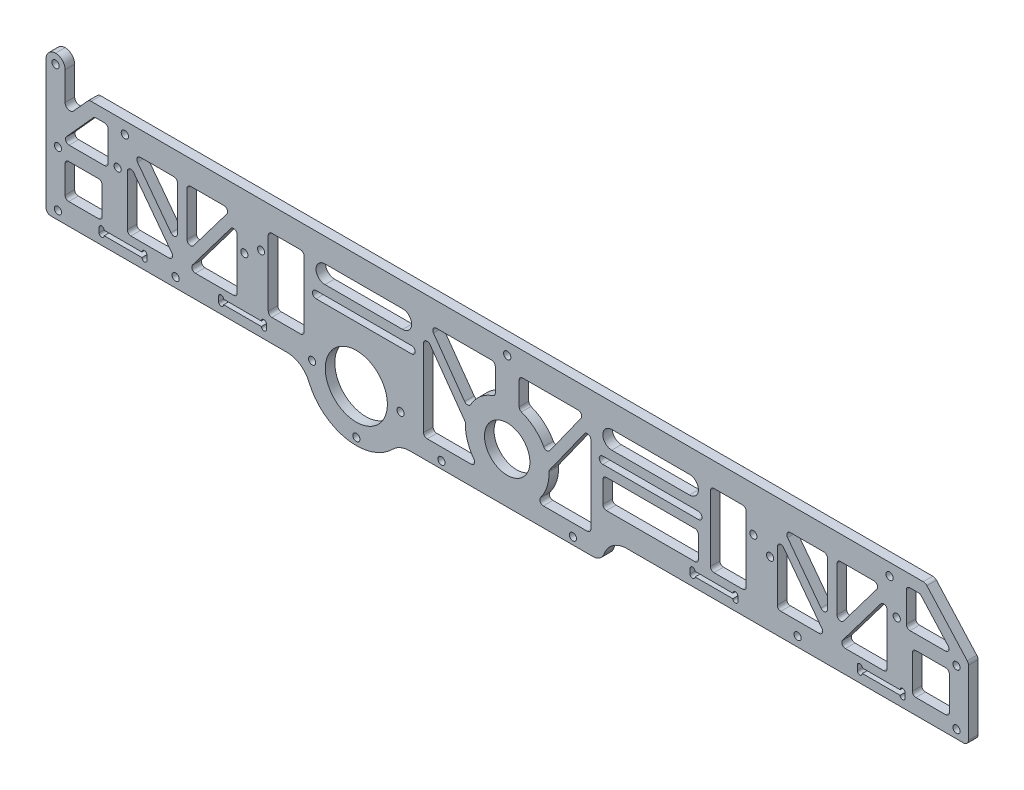
from build123d import *
from build123d.topology import SkipClean

# Parameters (mm, degrees)
SKETCH_1_W           = 386
SKETCH_1_H           = 50
EXTRUDE_1_DEPTH      = 4
SKETCH_2_R           = 1.525
CUT_EXTRUDE_1_DEPTH  = 33
SKETCH_3_R           = 1.5
CUT_EXTRUDE_2_DEPTH  = 5
SKETCH_4_W           = 80
SKETCH_4_H           = 20
EXTRUDE_3_DEPTH      = 4
FILLET_1_R           = 10
FILLET_2_R           = 5
SKETCH_5_R           = 9.5
CUT_EXTRUDE_3_DEPTH  = 40
SKETCH_6_W           = 45
SKETCH_6_H           = 10
EXTRUDE_4_DEPTH      = 4
SKETCH_7_R           = 6.55
CUT_EXTRUDE_4_DEPTH  = 10
SKETCH_8_R           = 21.512162348
SKETCH_8_R_2         = 6.55
EXTRUDE_5_DEPTH      = 4
SKETCH_10_R          = 13
CUT_EXTRUDE_5_DEPTH  = 21
CUT_EXTRUDE_6_DEPTH  = 10
SKETCH_12_R          = 1.5
CUT_EXTRUDE_7_DEPTH  = 10
CUT_EXTRUDE_8_DEPTH  = 10
SKETCH_15_R          = 1.5
CUT_EXTRUDE_9_DEPTH  = 10
SKETCH_16_R          = 1.5
CUT_EXTRUDE_10_DEPTH = 10
SKETCH_17_R          = 1.5
CUT_EXTRUDE_11_DEPTH = 10
SKETCH_18_R          = 1.5
CUT_EXTRUDE_12_DEPTH = 10
FILLET_3_R           = 10
FILLET_4_R           = 2
SKETCH_20_R          = 1.5
CUT_EXTRUDE_14_DEPTH = 50
SKETCH_21_W          = 20
SKETCH_21_H          = 2
CUT_EXTRUDE_15_DEPTH = 10
SKETCH_22_R          = 1.05
CUT_EXTRUDE_16_DEPTH = 10
SKETCH_23_R          = 1.05
CUT_EXTRUDE_17_DEPTH = 10
SKETCH_24_W          = 15.5
SKETCH_24_H          = 17
SKETCH_24_W_2        = 46
SKETCH_24_H_2        = 30.5
SKETCH_24_W_3        = 15
SKETCH_24_W_4        = 40
SKETCH_24_H_3        = 12
CUT_EXTRUDE_18_DEPTH = 10
EXTRUDE_6_DEPTH      = 4
EXTRUDE_7_DEPTH      = 4
FILLET_5_R           = 1.5
EXTRUDE_START        = -4
EXTRUDE_8_DEPTH      = 4
FILLET_6_R           = 1.5
EXTRUDE_9_DEPTH      = 4
SKETCH_29_R          = 1.5
CUT_EXTRUDE_19_DEPTH = 10
FILLET_7_R           = 4
FILLET_8_R           = 2


with BuildPart() as part:
    # 草图1 → 凸台-拉伸1 (new body)
    with BuildSketch(Plane.XY):
        Rectangle(SKETCH_1_W, SKETCH_1_H)
    extrude(amount=EXTRUDE_1_DEPTH)

    # 草图2 → 切除-拉伸1 (cut)
    with BuildSketch(Plane(origin=(0, 0, 0), x_dir=(-1, 0, 0), z_dir=(0, 0, -1))):
        with Locations((-160, 20)):
            Circle(SKETCH_2_R)
        with Locations((0, 20)):
            Circle(SKETCH_2_R)
        with Locations((160, 20)):
            Circle(SKETCH_2_R)
    extrude(amount=-CUT_EXTRUDE_1_DEPTH, mode=Mode.SUBTRACT)

    # 草图3 → 切除-拉伸2 (cut, symmetric)
    with BuildSketch(Plane(origin=(0, 0, 0), x_dir=(-1, 0, 0), z_dir=(0, 0, -1))):
        with Locations((-103, 6.5)):
            Circle(SKETCH_3_R)
        with Locations((-163, 6.5)):
            Circle(SKETCH_3_R)
        with Locations((163, 6.5)):
            Circle(SKETCH_3_R)
        with Locations((103, 6.5)):
            Circle(SKETCH_3_R)
    extrude(amount=CUT_EXTRUDE_2_DEPTH, both=True, mode=Mode.SUBTRACT)

    # 草图4 → 凸台-拉伸3 (add)
    with BuildSketch(Plane(origin=(0, 0, 0), x_dir=(-1, 0, 0), z_dir=(0, 0, -1))):
        with Locations((0, -25)):
            Rectangle(SKETCH_4_W, SKETCH_4_H)
    extrude(amount=-EXTRUDE_3_DEPTH)

    # 圆角1
    fillet_1_edges = [part.edges().sort_by_distance(p)[0] for p in [
        (-40, -25, 2),
        (40, -25, 2),
    ]]
    fillet(fillet_1_edges, radius=FILLET_1_R - 0.0001)  # a hair under: the kernel refuses the full size

    # 圆角2
    fillet_2_edges = [part.edges().sort_by_distance(p)[0] for p in [
        (40, -35, 2),
        (-40, -35, 2),
    ]]
    fillet(fillet_2_edges, radius=FILLET_2_R)

    # 草图5 → 切除-拉伸3 (cut)
    with BuildSketch(Plane(origin=(0, 0, 0), x_dir=(-1, 0, 0), z_dir=(0, 0, -1))):
        with Locations((0, -14)):
            Circle(SKETCH_5_R)
    extrude(amount=-CUT_EXTRUDE_3_DEPTH, mode=Mode.SUBTRACT)

    # 草图6 → 凸台-拉伸4 (add)
    with BuildSketch(Plane.XY.offset(4)):
        with Locations((-58.357864376, -30)):
            Rectangle(SKETCH_6_W, SKETCH_6_H)
    extrude(amount=-EXTRUDE_4_DEPTH)

    # 草图7 → 切除-拉伸4 (cut)
    with BuildSketch(Plane.XY.offset(4)):
        with Locations((-63.139706208, -22.8)):
            Circle(SKETCH_7_R)
    extrude(amount=-CUT_EXTRUDE_4_DEPTH, mode=Mode.SUBTRACT)

    # 草图8 → 凸台-拉伸5 (add)
    with BuildSketch(Plane.XY.offset(4)):
        with Locations((-63.139706208, -22.8)):
            Circle(SKETCH_8_R)
        with Locations((-63.139706208, -22.8)):
            Circle(SKETCH_8_R_2, mode=Mode.SUBTRACT)
    extrude(amount=-EXTRUDE_5_DEPTH)

    # 草图10 → 切除-拉伸5 (cut)
    with BuildSketch(Plane.XY.offset(4)):
        with Locations((-63.139706208, -22.8)):
            Circle(SKETCH_10_R)
    extrude(amount=-CUT_EXTRUDE_5_DEPTH, mode=Mode.SUBTRACT)

    # 草图11 → 切除-拉伸6 (cut)
    with BuildSketch(Plane.XY.offset(4)):
        with BuildLine():
            Line((-80, 3.5), (-40, 3.5))
            ThreePointArc((-40, 3.5), (-38.5, 2), (-40, 0.5))
            Line((-40, 0.5), (-80, 0.5))
            ThreePointArc((-80, 0.5), (-81.5, 2), (-80, 3.5))
        make_face()
        with BuildLine():
            Line((80, 3.5), (40, 3.5))
            ThreePointArc((40, 3.5), (38.5, 2), (40, 0.5))
            Line((40, 0.5), (80, 0.5))
            ThreePointArc((80, 0.5), (81.5, 2), (80, 3.5))
        make_face()
    extrude(amount=-CUT_EXTRUDE_6_DEPTH, mode=Mode.SUBTRACT)

    # 草图12 → 切除-拉伸7 (cut)
    with BuildSketch(Plane(origin=(0, 0, 0), x_dir=(-1, 0, 0), z_dir=(0, 0, -1))):
        with Locations((-110, 2)):
            Circle(SKETCH_12_R)
        with Locations((110, 2)):
            Circle(SKETCH_12_R)
    extrude(amount=-CUT_EXTRUDE_7_DEPTH, mode=Mode.SUBTRACT)

    # 草图13 → 切除-拉伸8 (cut)
    with BuildSketch(Plane.XY.offset(4)):
        Polygon((-175, 25), (-193, 5), (-193, 25), align=None)
        Polygon((193, 25), (175, 25), (193, 5), align=None)
    extrude(amount=-CUT_EXTRUDE_8_DEPTH, mode=Mode.SUBTRACT)

    # 草图15 → 切除-拉伸9 (cut)
    with BuildSketch(Plane.XY.offset(4)):
        with Locations((-138.769539184, -21)):
            Circle(SKETCH_15_R)
    extrude(amount=-CUT_EXTRUDE_9_DEPTH, mode=Mode.SUBTRACT)

    # 草图16 → 切除-拉伸10 (cut)
    with BuildSketch(Plane.XY.offset(4)):
        with Locations((121.5, -21)):
            Circle(SKETCH_16_R)
    extrude(amount=-CUT_EXTRUDE_10_DEPTH, mode=Mode.SUBTRACT)

    # 草图17 → 切除-拉伸11 (cut)
    with BuildSketch(Plane.XY.offset(4)):
        with Locations((27.5, -32)):
            Circle(SKETCH_17_R)
        with Locations((-27.5, -32)):
            Circle(SKETCH_17_R)
    extrude(amount=-CUT_EXTRUDE_11_DEPTH, mode=Mode.SUBTRACT)

    # 草图18 → 切除-拉伸12 (cut)
    with BuildSketch(Plane.XY.offset(4)):
        with Locations((-63.139706208, -41.312162348)):
            Circle(SKETCH_18_R)
        with Locations((-44.62754386, -22.8)):
            Circle(SKETCH_18_R)
        with Locations((-81.651868556, -22.8)):
            Circle(SKETCH_18_R)
    extrude(amount=-CUT_EXTRUDE_12_DEPTH, mode=Mode.SUBTRACT)

    # 圆角3
    fillet_3_edges = [part.edges().sort_by_distance(p)[0] for p in [
        (-84.539078369, -25, 2),
        (-45.421548039, -35, 2),
    ]]
    fillet(fillet_3_edges, radius=FILLET_3_R)

    # 圆角4
    fillet_4_edges = [part.edges().sort_by_distance(p)[0] for p in [
        (-175, 25, 2),
        (-193, 5, 2),
        (193, 5, 2),
        (175, 25, 2),
        (193, -25, 2),
        (-193, -25, 2),
    ]]
    fillet(fillet_4_edges, radius=FILLET_4_R)

    # 草图20 → 切除-拉伸14 (cut)
    with BuildSketch(Plane.XY.offset(4)):
        with Locations((-188, -21.5)):
            Circle(SKETCH_20_R)
        with Locations((-188, 1.5)):
            Circle(SKETCH_20_R)
        with Locations(Location((188, 1.5, 0), (0, 0, 180))):
            Circle(SKETCH_20_R)
        with Locations(Location((188, -21.5, 0), (0, 0, 180))):
            Circle(SKETCH_20_R)
    extrude(amount=-CUT_EXTRUDE_14_DEPTH, mode=Mode.SUBTRACT)

    # 草图21 → 切除-拉伸15 (cut)
    with BuildSketch(Plane.XY.offset(4)):
        with Locations((-160.769539184, -20)):
            Rectangle(SKETCH_21_W, SKETCH_21_H)
        with Locations((-110.769539184, -20)):
            Rectangle(SKETCH_21_W, SKETCH_21_H)
        with Locations((86.5, -20)):
            Rectangle(SKETCH_21_W, SKETCH_21_H)
        with Locations((156.5, -20)):
            Rectangle(SKETCH_21_W, SKETCH_21_H)
    extrude(amount=-CUT_EXTRUDE_15_DEPTH, mode=Mode.SUBTRACT)

    # 草图22 → 切除-拉伸16 (cut)
    with BuildSketch(Plane.XY.offset(4)):
        with Locations((-151.819539184, -21)):
            Circle(SKETCH_22_R)
        with Locations((-151.819539184, -19)):
            Circle(SKETCH_22_R)
        with Locations((-169.719539184, -19)):
            Circle(SKETCH_22_R)
        with Locations((-169.719539184, -21)):
            Circle(SKETCH_22_R)
        with Locations((-119.719539184, -21)):
            Circle(SKETCH_22_R)
        with Locations((-119.719539184, -19)):
            Circle(SKETCH_22_R)
        with Locations((-101.819539184, -21)):
            Circle(SKETCH_22_R)
        with Locations((-101.819539184, -19)):
            Circle(SKETCH_22_R)
    extrude(amount=-CUT_EXTRUDE_16_DEPTH, mode=Mode.SUBTRACT)

    # 草图23 → 切除-拉伸17 (cut)
    with BuildSketch(Plane.XY.offset(4)):
        with Locations((77.55, -21)):
            Circle(SKETCH_23_R)
        with Locations((77.55, -19)):
            Circle(SKETCH_23_R)
        with Locations((95.45, -21)):
            Circle(SKETCH_23_R)
        with Locations((95.45, -19)):
            Circle(SKETCH_23_R)
        with Locations((147.55, -19)):
            Circle(SKETCH_23_R)
        with Locations((147.55, -21)):
            Circle(SKETCH_23_R)
        with Locations((165.45, -21)):
            Circle(SKETCH_23_R)
        with Locations((165.45, -19)):
            Circle(SKETCH_23_R)
    extrude(amount=-CUT_EXTRUDE_17_DEPTH, mode=Mode.SUBTRACT)

    # 草图24 → 切除-拉伸18 (cut)
    with BuildSketch(Plane(origin=(0, 0, 0), x_dir=(-1, 0, 0), z_dir=(0, 0, -1))):
        Polygon((-172.773187976, 20), (-186.723187976, 4.5), (-167, 4.5), (-167, 20), align=None)
        with Locations((-177.25, -10)):
            Rectangle(SKETCH_24_W, SKETCH_24_H)
        with Locations((-136, -0.25)):
            Rectangle(SKETCH_24_W_2, SKETCH_24_H_2)
        with Locations((-92.5, -0.25)):
            Rectangle(SKETCH_24_W_3, SKETCH_24_H_2)
        with BuildLine():
            Line((-76.25, 15), (-43.75, 15))
            ThreePointArc((-43.75, 15), (-40, 11.25), (-43.75, 7.5))
            Line((-43.75, 7.5), (-76.25, 7.5))
            ThreePointArc((-76.25, 7.5), (-80, 11.25), (-76.25, 15))
        make_face()
        with Locations((-60, -9.5)):
            Rectangle(SKETCH_24_W_4, SKETCH_24_H_3)
        with BuildLine():
            Line((-35, 15), (-35, -27))
            Line((-35, -27), (-11.715374514, -27))
            ThreePointArc((-11.715374514, -27), (-17.07107935, -10.149253344), (-5, 2.770509831))
            Line((-5, 2.770509831), (-5, 15))
            Line((-5, 15), (-35, 15))
        make_face()
        with BuildLine():
            Line((5, 15), (5, 2.770509831))
            ThreePointArc((5, 2.770509831), (17.07107935, -10.149253344), (11.715374514, -27))
            Line((11.715374514, -27), (35, -27))
            Line((35, -27), (35, 15))
            Line((35, 15), (5, 15))
        make_face()
        with BuildLine():
            Line((76.25, 15), (43.75, 15))
            ThreePointArc((43.75, 15), (40, 11.25), (43.75, 7.5))
            Line((43.75, 7.5), (76.25, 7.5))
            ThreePointArc((76.25, 7.5), (80, 11.25), (76.25, 15))
        make_face()
        with Locations((92.5, -0.25)):
            Rectangle(SKETCH_24_W_3, SKETCH_24_H_2)
        Polygon((167, 20), (172.773187976, 20), (186.723187976, 4.5), (167, 4.5), align=None)
        with Locations((177.25, -10)):
            Rectangle(SKETCH_24_W, SKETCH_24_H)
        with Locations((136, -0.25)):
            Rectangle(SKETCH_24_W_2, SKETCH_24_H_2)
    extrude(amount=-CUT_EXTRUDE_18_DEPTH, mode=Mode.SUBTRACT)

    # 草图25 → 凸台-拉伸6 (add)
    with BuildSketch(Plane(origin=(0, 0, 0), x_dir=(-1, 0, 0), z_dir=(0, 0, -1))):
        Polygon((-138, -9.526075575), (-157.403146833, 16.204184356), (-160.596853167, 13.795815644), (-137.596853167, -16.704184356), (-136, -15.5), (-138, -15.5), align=None)
        Polygon((-138, 15), (-138, -9.526075575), (-136, -12.178249488), (-134, -9.526075575), (-134, 15), align=None)
        Polygon((-114.596853167, 16.204184356), (-134, -9.526075575), (-134, -15.5), (-136, -15.5), (-134.403146833, -16.704184356), (-111.403146833, 13.795815644), align=None)
        Polygon((-134, -9.526075575), (-136, -12.178249488), (-134.403146833, -14.295815644), (-136, -15.5), (-134, -15.5), align=None)
        Polygon((-136, -12.178249488), (-138, -9.526075575), (-138, -15.5), (-136, -15.5), (-137.596853167, -14.295815644), align=None)
        Polygon((-134.403146833, -14.295815644), (-136, -12.178249488), (-137.596853167, -14.295815644), (-136, -15.5), align=None)
    extrude_6 = extrude(amount=-EXTRUDE_6_DEPTH)

    # 镜向1: 凸台-拉伸6 across plane
    add(extrude_6.mirror(Plane(origin=(0, 0, 0), x_dir=(0, 0, 1), z_dir=(1, 0, 0))))

    # 草图26 → 凸台-拉伸7 (add)
    with BuildSketch(Plane(origin=(0, 0, 0), x_dir=(-1, 0, 0), z_dir=(0, 0, -1))):
        with BuildLine():
            Line((-35, 15), (-32.543801777, 15))
            Line((-32.543801777, 15), (-16.338685256, -7.731239031))
            ThreePointArc((-16.338685256, -7.731239031), (-17.112295954, -10.336760017), (-17.473132196, -13.030643891))
            Line((-17.473132196, -13.030643891), (-35, 11.554641935))
            Line((-35, 11.554641935), (-35, 15))
        make_face()
    extrude_7 = extrude(amount=-EXTRUDE_7_DEPTH)

    # 镜向2: 凸台-拉伸7 across plane
    add(extrude_7.mirror(Plane(origin=(0, 0, 0), x_dir=(0, 0, 1), z_dir=(1, 0, 0))))

    # 圆角5
    fillet_5_edges = [part.edges().sort_by_distance(p)[0] for p in [
        (-133.495073384, -15.5, 2),
        (-138.504926616, -15.5, 2),
        (-115.504926616, 15, 2),
        (-156.495073384, 15, 2),
        (-138, -9.526075575, 2),
        (-159, 11.678249488, 2),
        (-113, 11.678249488, 2),
        (-138, 15, 2),
        (-134, 15, 2),
        (-134, -9.526075575, 2),
        (35, 11.554641935, 2),
        (32.543801777, 15, 2),
        (16.338685256, -7.731239031, 2),
        (17.473132196, -13.030643891, 2),
        (-32.543801777, 15, 2),
        (-16.338685256, -7.731239031, 2),
        (-17.473132196, -13.030643891, 2),
        (-35, 11.554641935, 2),
        (-100, -15.5, 2),
        (-85, -15.5, 2),
        (-85, 15, 2),
        (-100, 15, 2),
        (-167, 4.5, 2),
        (-167, 20, 2),
        (-172.773187976, 20, 2),
        (-186.723187976, 4.5, 2),
        (-169.5, -1.5, 2),
        (-185, -1.5, 2),
        (-185, -18.5, 2),
        (-113, -15.5, 2),
        (-159, -15.5, 2),
        (169.5, -18.5, 2),
        (185, -18.5, 2),
        (185, -1.5, 2),
        (169.5, -1.5, 2),
        (159, -15.5, 2),
        (113, -15.5, 2),
        (100, 15, 2),
        (85, 15, 2),
        (85, -15.5, 2),
        (100, -15.5, 2),
        (80, -3.5, 2),
        (40, -3.5, 2),
        (40, -15.5, 2),
        (80, -15.5, 2),
        (5, 15, 2),
        (5, 2.770509831, 2),
        (11.715374514, -27, 2),
        (35, -27, 2),
        (-11.715374514, -27, 2),
        (-5, 2.770509831, 2),
        (-5, 15, 2),
        (-35, -27, 2),
        (172.773187976, 20, 2),
        (167, 20, 2),
        (167, 4.5, 2),
        (186.723187976, 4.5, 2),
        (133.495073384, -15.5, 2),
        (138.504926616, -15.5, 2),
        (115.504926616, 15, 2),
        (156.495073384, 15, 2),
        (134, -9.526075575, 2),
        (159, 11.678249488, 2),
        (113, 11.678249488, 2),
        (138, -9.526075575, 2),
        (138, 15, 2),
        (134, 15, 2),
    ]]
    fillet(fillet_5_edges, radius=FILLET_5_R)

    # 草图27 → 凸台-拉伸8 (add)
    with SkipClean():  # the faces are left unmerged after this step: merging them gives an invalid solid
        with BuildSketch(Plane(origin=(0, 0, 0), x_dir=(-1, 0, 0), z_dir=(0, 0, -1)).offset(EXTRUDE_START)):
            with BuildLine():
                Line((185, -18.5), (170.64284845, -18.5))
                ThreePointArc((170.64284845, -18.5), (170.159085119, -18.046428099), (169.5, -17.973207642))
                Line((169.5, -17.973207642), (169.5, -16))
                Line((169.5, -16), (185, -16))
                Line((185, -16), (185, -18.5))
            make_face()
        extrude(amount=EXTRUDE_8_DEPTH)

    # 圆角6
    fillet_6_edges = [part.edges().sort_by_distance(p)[0] for p in [
        (-185, -16, 2),
        (-169.5, -16, 2),
    ]]
    fillet(fillet_6_edges, radius=FILLET_6_R)

    # 草图28 → 凸台-拉伸9 (add)
    with SkipClean():  # the faces are left unmerged after this step: merging them gives an invalid solid
        with BuildSketch(Plane(origin=(0, 0, 0), x_dir=(-1, 0, 0), z_dir=(0, 0, -1))):
            Polygon((193, 4.23252799), (193, 35), (185, 35), (185, 13.888888889), align=None)
        extrude(amount=-EXTRUDE_9_DEPTH)

    # 草图29 → 切除-拉伸19 (cut)
    with SkipClean():  # the faces are left unmerged after this step: merging them gives an invalid solid
        with BuildSketch(Plane.XY.offset(4)):
            with Locations((-189, 31)):
                Circle(SKETCH_29_R)
        extrude(amount=-CUT_EXTRUDE_19_DEPTH, mode=Mode.SUBTRACT)

    # 圆角7
    fillet_7_edges = [part.edges().sort_by_distance(p)[0] for p in [
        (-185, 35, 2),
        (-193, 35, 2),
    ]]
    fillet(fillet_7_edges, radius=FILLET_7_R - 0.0001)  # a hair under: the kernel refuses the full size

    # 圆角8
    fillet_8_edges = [part.edges().sort_by_distance(p)[0] for p in [
        (-185, 13.888888889, 2),
    ]]
    fillet(fillet_8_edges, radius=FILLET_8_R)


solid = part.part
